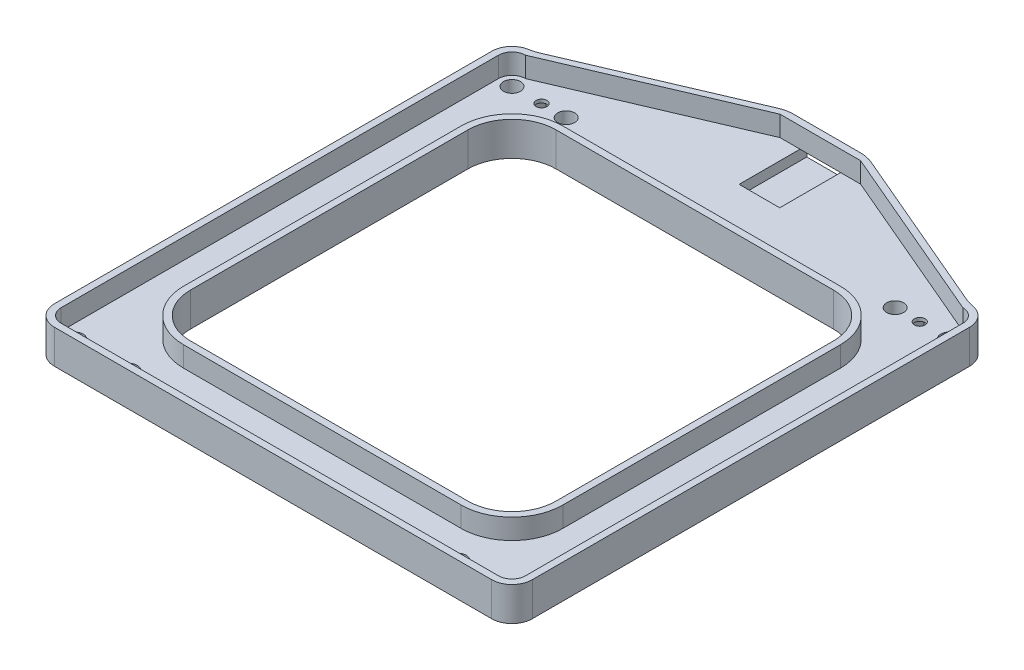
from build123d import *

# Parameters (mm, degrees)
BOSS_EXTRUDE1_DEPTH = 10
CUT_EXTRUDE1_DEPTH  = 6
SKETCH3_R           = 2.5
SKETCH3_R_2         = 1.6
CUT_EXTRUDE5_DEPTH  = 118.268793803
CUT_EXTRUDE6_DEPTH  = 3
FILLET1_R           = 10
SKETCH7_W           = 12
SKETCH7_H           = 3
CUT_EXTRUDE7_DEPTH  = 20


with BuildPart() as part:
    # Sketch1 → Boss-Extrude1 (new body)
    with BuildSketch(Plane(origin=(0, 0, 0), x_dir=(1, 0, 0), z_dir=(0, 1, 0))):
        with BuildLine():
            Line((-64.6, 70.6), (-13.781138102, 92.296857547))
            ThreePointArc((-13.781138102, 92.296857547), (-11.858510235, 92.897157125), (-9.854586018, 93.1))
            Line((-9.854586018, 93.1), (9.854586018, 93.1))
            ThreePointArc((9.854586018, 93.1), (11.858510235, 92.897157125), (13.781138102, 92.296857547))
            Line((13.781138102, 92.296857547), (64.6, 70.6))
            ThreePointArc((64.6, 70.6), (68.842640687, 68.842640687), (70.6, 64.6))
            Line((70.6, 64.6), (70.6, -64.6))
            ThreePointArc((70.6, -64.6), (68.842640687, -68.842640687), (64.6, -70.6))
            Line((64.6, -70.6), (-64.6, -70.6))
            ThreePointArc((-64.6, -70.6), (-68.842640687, -68.842640687), (-70.6, -64.6))
            Line((-70.6, -64.6), (-70.6, 64.6))
            ThreePointArc((-70.6, 64.6), (-68.842640687, 68.842640687), (-64.6, 70.6))
        make_face()
        with BuildLine():
            Line((-41, -54), (41, -54))
            ThreePointArc((41, -54), (50.192388155, -50.192388155), (54, -41))
            Line((54, -41), (54, 41))
            ThreePointArc((54, 41), (50.192388155, 50.192388155), (41, 54))
            Line((41, 54), (-41, 54))
            ThreePointArc((-41, 54), (-50.192388155, 50.192388155), (-54, 41))
            Line((-54, 41), (-54, -41))
            ThreePointArc((-54, -41), (-50.192388155, -50.192388155), (-41, -54))
        make_face(mode=Mode.SUBTRACT)
    extrude(amount=BOSS_EXTRUDE1_DEPTH)

    # Sketch2 → Cut-Extrude1 (cut)
    with BuildSketch(Plane(origin=(0, 10, 0), x_dir=(1, 0, 0), z_dir=(0, 1, 0))):
        with BuildLine():
            Line((-64.6, 68.6), (-11.9, 91.1))
            Line((-11.9, 91.1), (11.9, 91.1))
            Line((11.9, 91.1), (64.6, 68.6))
            ThreePointArc((64.6, 68.6), (67.428427125, 67.428427125), (68.6, 64.6))
            Line((68.6, 64.6), (68.6, -64.6))
            ThreePointArc((68.6, -64.6), (67.428427125, -67.428427125), (64.6, -68.6))
            Line((64.6, -68.6), (-64.6, -68.6))
            ThreePointArc((-64.6, -68.6), (-67.428427125, -67.428427125), (-68.6, -64.6))
            Line((-68.6, -64.6), (-68.6, 64.6))
            ThreePointArc((-68.6, 64.6), (-67.428427125, 67.428427125), (-64.6, 68.6))
        make_face()
        with BuildLine():
            Line((-41, -56), (41, -56))
            ThreePointArc((41, -56), (51.606601718, -51.606601718), (56, -41))
            Line((56, -41), (56, 41))
            ThreePointArc((56, 41), (51.606601718, 51.606601718), (41, 56))
            Line((41, 56), (-41, 56))
            ThreePointArc((-41, 56), (-51.606601718, 51.606601718), (-56, 41))
            Line((-56, 41), (-56, -41))
            ThreePointArc((-56, -41), (-51.606601718, -51.606601718), (-41, -56))
        make_face(mode=Mode.SUBTRACT)
    extrude(amount=-CUT_EXTRUDE1_DEPTH, mode=Mode.SUBTRACT)

    # Sketch3 → Cut-Extrude5 (cut, through all)
    with BuildSketch(Plane(origin=(0, 0, 0), x_dir=(1, 0, 0), z_dir=(0, 1, 0))):
        with Locations((-64.6, 64.6)):
            Circle(SKETCH3_R)
        with Locations((-48.6, 64.6)):
            Circle(SKETCH3_R)
        with Locations((-55.87, 64.6)):
            Circle(SKETCH3_R_2)
        with Locations((55.87, 64.6)):
            Circle(SKETCH3_R_2)
        with Locations((48.6, 64.6)):
            Circle(SKETCH3_R)
        with Locations((64.6, 64.6)):
            Circle(SKETCH3_R)
        with Locations((64.6, -64.6)):
            Circle(SKETCH3_R)
        with Locations((48.6, -64.6)):
            Circle(SKETCH3_R)
        with Locations((55.87, -64.6)):
            Circle(SKETCH3_R_2)
        with Locations((-55.87, -64.6)):
            Circle(SKETCH3_R_2)
        with Locations((-48.6, -64.6)):
            Circle(SKETCH3_R)
        with Locations((-64.6, -64.6)):
            Circle(SKETCH3_R)
    extrude(amount=CUT_EXTRUDE5_DEPTH, mode=Mode.SUBTRACT)

    # Sketch6 → Cut-Extrude6 (cut)
    with BuildSketch(Plane.XZ):
        Polygon((-52.405898385, 64.6), (-54.137949192, 67.6), (-57.602050808, 67.6), (-59.334101615, 64.6), (-57.602050808, 61.6), (-54.137949192, 61.6), align=None)
        Polygon((-54.137949192, -61.6), (-52.405898385, -64.6), (-54.137949192, -67.6), (-57.602050808, -67.6), (-59.334101615, -64.6), (-57.602050808, -61.6), align=None)
        Polygon((52.405898385, -64.6), (54.137949192, -67.6), (57.602050808, -67.6), (59.334101615, -64.6), (57.602050808, -61.6), (54.137949192, -61.6), align=None)
        Polygon((54.137949192, 61.6), (52.405898385, 64.6), (54.137949192, 67.6), (57.602050808, 67.6), (59.334101615, 64.6), (57.602050808, 61.6), align=None)
    extrude(amount=-CUT_EXTRUDE6_DEPTH, mode=Mode.SUBTRACT)

    # Fillet1
    fillet1_edges = [part.edges().sort_by_distance(p)[0] for p in [
        (64.6, 5, -70.6),
        (-64.6, 5, -70.6),
    ]]
    fillet(fillet1_edges, radius=FILLET1_R)

    # Sketch7 → Cut-Extrude7 (cut)
    with BuildSketch(Plane(origin=(0, 0, -93.1), x_dir=(-1, 0, 0), z_dir=(0, 0, -1))):
        with Locations((0, 2.5)):
            Rectangle(SKETCH7_W, SKETCH7_H)
    extrude(amount=-CUT_EXTRUDE7_DEPTH, mode=Mode.SUBTRACT)


solid = part.part
